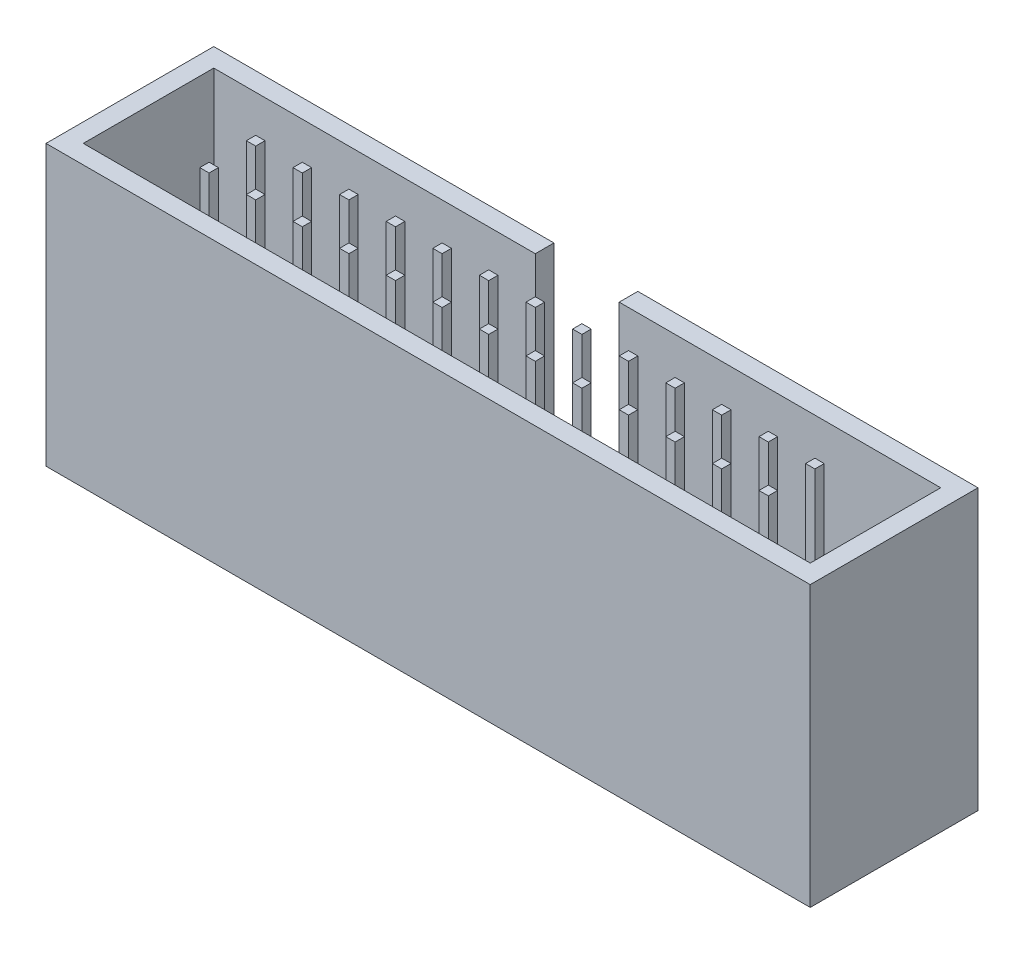
from build123d import *

# Parameters (mm, degrees)
SKETCH_504_W             = 41
SKETCH_504_H             = 9
EXTRUDE_794_DEPTH        = 15
CUT_EXTRUDE_START        = 15
SKETCH_4_W               = 39
SKETCH_4_H               = 7
CUT_EXTRUDE_8_DEPTH      = 10
SKETCH_5_W               = 4.5
SKETCH_5_H               = 6.901015062
CUT_EXTRUDE_9_DEPTH      = 10
SKETCH_6_W               = 0.5
SKETCH_6_H               = 0.5
EXTRUDE1_DEPTH           = 10
LPATTERN1_COUNT          = 7
LPATTERN1_PITCH          = 2.5
LPATTERN1_COUNT_DIR2     = 7
LPATTERN1_PITCH_DIR2     = 2.5
MIRROR1_COPY_1_SKETCH_W  = 0.5
MIRROR1_COPY_1_SKETCH_H  = 0.5
MIRROR1_COPY_1_DEPTH     = 10
MIRROR1_COPY_2_SKETCH_W  = 0.5
MIRROR1_COPY_2_SKETCH_H  = 0.5
MIRROR1_COPY_2_DEPTH     = 10
MIRROR1_COPY_3_SKETCH_W  = 0.5
MIRROR1_COPY_3_SKETCH_H  = 0.5
MIRROR1_COPY_3_DEPTH     = 10
MIRROR1_COPY_4_SKETCH_W  = 0.5
MIRROR1_COPY_4_SKETCH_H  = 0.5
MIRROR1_COPY_4_DEPTH     = 10
MIRROR1_COPY_5_SKETCH_W  = 0.5
MIRROR1_COPY_5_SKETCH_H  = 0.5
MIRROR1_COPY_5_DEPTH     = 10
MIRROR1_COPY_6_SKETCH_W  = 0.5
MIRROR1_COPY_6_SKETCH_H  = 0.5
MIRROR1_COPY_6_DEPTH     = 10
MIRROR1_COPY_7_SKETCH_W  = 0.5
MIRROR1_COPY_7_SKETCH_H  = 0.5
MIRROR1_COPY_7_DEPTH     = 10
MIRROR1_COPY_8_SKETCH_W  = 0.5
MIRROR1_COPY_8_SKETCH_H  = 0.5
MIRROR1_COPY_8_DEPTH     = 10
MIRROR1_COPY_9_SKETCH_W  = 0.5
MIRROR1_COPY_9_SKETCH_H  = 0.5
MIRROR1_COPY_9_DEPTH     = 10
MIRROR1_COPY_10_SKETCH_W = 0.5
MIRROR1_COPY_10_SKETCH_H = 0.5
MIRROR1_COPY_10_DEPTH    = 10
MIRROR1_COPY_11_SKETCH_W = 0.5
MIRROR1_COPY_11_SKETCH_H = 0.5
MIRROR1_COPY_11_DEPTH    = 10
MIRROR1_COPY_12_SKETCH_W = 0.5
MIRROR1_COPY_12_SKETCH_H = 0.5
MIRROR1_COPY_12_DEPTH    = 10
MIRROR1_COPY_13_SKETCH_W = 0.5
MIRROR1_COPY_13_SKETCH_H = 0.5
MIRROR1_COPY_13_DEPTH    = 10
MIRROR1_COPY_14_SKETCH_W = 0.5
MIRROR1_COPY_14_SKETCH_H = 0.5
MIRROR1_COPY_14_DEPTH    = 10
MIRROR1_COPY_15_SKETCH_W = 0.5
MIRROR1_COPY_15_SKETCH_H = 0.5
MIRROR1_COPY_15_DEPTH    = 10
MIRROR1_COPY_16_SKETCH_W = 0.5
MIRROR1_COPY_16_SKETCH_H = 0.5
MIRROR1_COPY_16_DEPTH    = 10
MIRROR1_COPY_17_SKETCH_W = 0.5
MIRROR1_COPY_17_SKETCH_H = 0.5
MIRROR1_COPY_17_DEPTH    = 10
MIRROR1_COPY_18_SKETCH_W = 0.5
MIRROR1_COPY_18_SKETCH_H = 0.5
MIRROR1_COPY_18_DEPTH    = 10
MIRROR1_COPY_19_SKETCH_W = 0.5
MIRROR1_COPY_19_SKETCH_H = 0.5
MIRROR1_COPY_19_DEPTH    = 10
MIRROR1_COPY_20_SKETCH_W = 0.5
MIRROR1_COPY_20_SKETCH_H = 0.5
MIRROR1_COPY_20_DEPTH    = 10
MIRROR1_COPY_21_SKETCH_W = 0.5
MIRROR1_COPY_21_SKETCH_H = 0.5
MIRROR1_COPY_21_DEPTH    = 10
MIRROR1_COPY_22_SKETCH_W = 0.5
MIRROR1_COPY_22_SKETCH_H = 0.5
MIRROR1_COPY_22_DEPTH    = 10
MIRROR1_COPY_23_SKETCH_W = 0.5
MIRROR1_COPY_23_SKETCH_H = 0.5
MIRROR1_COPY_23_DEPTH    = 10
MIRROR1_COPY_24_SKETCH_W = 0.5
MIRROR1_COPY_24_SKETCH_H = 0.5
MIRROR1_COPY_24_DEPTH    = 10
MIRROR1_COPY_25_SKETCH_W = 0.5
MIRROR1_COPY_25_SKETCH_H = 0.5
MIRROR1_COPY_25_DEPTH    = 10
MIRROR1_COPY_26_SKETCH_W = 0.5
MIRROR1_COPY_26_SKETCH_H = 0.5
MIRROR1_COPY_26_DEPTH    = 10
MIRROR1_COPY_27_SKETCH_W = 0.5
MIRROR1_COPY_27_SKETCH_H = 0.5
MIRROR1_COPY_27_DEPTH    = 10
MIRROR1_COPY_28_SKETCH_W = 0.5
MIRROR1_COPY_28_SKETCH_H = 0.5
MIRROR1_COPY_28_DEPTH    = 10
MIRROR1_COPY_29_SKETCH_W = 0.5
MIRROR1_COPY_29_SKETCH_H = 0.5
MIRROR1_COPY_29_DEPTH    = 10
MIRROR1_COPY_30_SKETCH_W = 0.5
MIRROR1_COPY_30_SKETCH_H = 0.5
MIRROR1_COPY_30_DEPTH    = 10
MIRROR1_COPY_31_SKETCH_W = 0.5
MIRROR1_COPY_31_SKETCH_H = 0.5
MIRROR1_COPY_31_DEPTH    = 10
MIRROR1_COPY_32_SKETCH_W = 0.5
MIRROR1_COPY_32_SKETCH_H = 0.5
MIRROR1_COPY_32_DEPTH    = 10
MIRROR1_COPY_33_SKETCH_W = 0.5
MIRROR1_COPY_33_SKETCH_H = 0.5
MIRROR1_COPY_33_DEPTH    = 10
MIRROR1_COPY_34_SKETCH_W = 0.5
MIRROR1_COPY_34_SKETCH_H = 0.5
MIRROR1_COPY_34_DEPTH    = 10
MIRROR1_COPY_35_SKETCH_W = 0.5
MIRROR1_COPY_35_SKETCH_H = 0.5
MIRROR1_COPY_35_DEPTH    = 10
MIRROR1_COPY_36_SKETCH_W = 0.5
MIRROR1_COPY_36_SKETCH_H = 0.5
MIRROR1_COPY_36_DEPTH    = 10
MIRROR1_COPY_37_SKETCH_W = 0.5
MIRROR1_COPY_37_SKETCH_H = 0.5
MIRROR1_COPY_37_DEPTH    = 10
MIRROR1_COPY_38_SKETCH_W = 0.5
MIRROR1_COPY_38_SKETCH_H = 0.5
MIRROR1_COPY_38_DEPTH    = 10
MIRROR1_COPY_39_SKETCH_W = 0.5
MIRROR1_COPY_39_SKETCH_H = 0.5
MIRROR1_COPY_39_DEPTH    = 10
MIRROR1_COPY_40_SKETCH_W = 0.5
MIRROR1_COPY_40_SKETCH_H = 0.5
MIRROR1_COPY_40_DEPTH    = 10
MIRROR1_COPY_41_SKETCH_W = 0.5
MIRROR1_COPY_41_SKETCH_H = 0.5
MIRROR1_COPY_41_DEPTH    = 10
MIRROR1_COPY_42_SKETCH_W = 0.5
MIRROR1_COPY_42_SKETCH_H = 0.5
MIRROR1_COPY_42_DEPTH    = 10
MIRROR1_COPY_43_SKETCH_W = 0.5
MIRROR1_COPY_43_SKETCH_H = 0.5
MIRROR1_COPY_43_DEPTH    = 10
MIRROR1_COPY_44_SKETCH_W = 0.5
MIRROR1_COPY_44_SKETCH_H = 0.5
MIRROR1_COPY_44_DEPTH    = 10
MIRROR1_COPY_45_SKETCH_W = 0.5
MIRROR1_COPY_45_SKETCH_H = 0.5
MIRROR1_COPY_45_DEPTH    = 10
MIRROR1_COPY_46_SKETCH_W = 0.5
MIRROR1_COPY_46_SKETCH_H = 0.5
MIRROR1_COPY_46_DEPTH    = 10
MIRROR1_COPY_47_SKETCH_W = 0.5
MIRROR1_COPY_47_SKETCH_H = 0.5
MIRROR1_COPY_47_DEPTH    = 10
MIRROR1_COPY_48_SKETCH_W = 0.5
MIRROR1_COPY_48_SKETCH_H = 0.5
MIRROR1_COPY_48_DEPTH    = 10
MIRROR1_COPY_49_SKETCH_W = 0.5
MIRROR1_COPY_49_SKETCH_H = 0.5
MIRROR1_COPY_49_DEPTH    = 10


with BuildPart() as part:
    # Sketch 504 → Extrude 794 (new body)
    with BuildSketch(Plane(origin=(0, 0, 0), x_dir=(1, 0, 0), z_dir=(0, 1, 0))):
        Rectangle(SKETCH_504_W, SKETCH_504_H)
    extrude(amount=EXTRUDE_794_DEPTH)

    # 草图4 → 切除-拉伸8 (cut)
    with BuildSketch(Plane(origin=(0, 0, 0), x_dir=(1, 0, 0), z_dir=(0, 1, 0)).offset(CUT_EXTRUDE_START)):
        Rectangle(SKETCH_4_W, SKETCH_4_H)
    extrude(amount=-CUT_EXTRUDE_8_DEPTH, mode=Mode.SUBTRACT)

    # 草图5 → 切除-拉伸9 (cut)
    with BuildSketch(Plane(origin=(0, 15, 0), x_dir=(1, 0, 0), z_dir=(0, 1, 0))):
        with Locations((0, 3.450507531)):
            Rectangle(SKETCH_5_W, SKETCH_5_H)
    extrude(amount=-CUT_EXTRUDE_9_DEPTH, mode=Mode.SUBTRACT)

    # 草图6 → Extrude1 (add)
    with BuildSketch(Plane(origin=(0, 5, 0), x_dir=(1, 0, 0), z_dir=(0, 1, 0))):
        with Locations((0, 1.25)):
            Rectangle(SKETCH_6_W, SKETCH_6_H)
    extrude1 = extrude(amount=EXTRUDE1_DEPTH)

    # LPattern1: Extrude1 7 × 7
    with Locations(*[Vector(1, 0, 0) * (i * LPATTERN1_PITCH) + Vector(-1, 0, 0) * (j * LPATTERN1_PITCH_DIR2) for i in range(LPATTERN1_COUNT) for j in range(LPATTERN1_COUNT_DIR2) if (i, j) != (0, 0)]):
        add(extrude1)

    # Mirror1 copy 1 sketch → Mirror1 copy 1 (add)
    with BuildSketch(Plane(origin=(-2.5, 5, 0), x_dir=(1, 0, 0), z_dir=(0, 1, 0))):
        with Locations((0, -1.25)):
            Rectangle(MIRROR1_COPY_1_SKETCH_W, MIRROR1_COPY_1_SKETCH_H)
    extrude(amount=MIRROR1_COPY_1_DEPTH)

    # Mirror1 copy 2 sketch → Mirror1 copy 2 (add)
    with BuildSketch(Plane(origin=(-5, 5, 0), x_dir=(1, 0, 0), z_dir=(0, 1, 0))):
        with Locations((0, -1.25)):
            Rectangle(MIRROR1_COPY_2_SKETCH_W, MIRROR1_COPY_2_SKETCH_H)
    extrude(amount=MIRROR1_COPY_2_DEPTH)

    # Mirror1 copy 3 sketch → Mirror1 copy 3 (add)
    with BuildSketch(Plane(origin=(-7.5, 5, 0), x_dir=(1, 0, 0), z_dir=(0, 1, 0))):
        with Locations((0, -1.25)):
            Rectangle(MIRROR1_COPY_3_SKETCH_W, MIRROR1_COPY_3_SKETCH_H)
    extrude(amount=MIRROR1_COPY_3_DEPTH)

    # Mirror1 copy 4 sketch → Mirror1 copy 4 (add)
    with BuildSketch(Plane(origin=(-10, 5, 0), x_dir=(1, 0, 0), z_dir=(0, 1, 0))):
        with Locations((0, -1.25)):
            Rectangle(MIRROR1_COPY_4_SKETCH_W, MIRROR1_COPY_4_SKETCH_H)
    extrude(amount=MIRROR1_COPY_4_DEPTH)

    # Mirror1 copy 5 sketch → Mirror1 copy 5 (add)
    with BuildSketch(Plane(origin=(-12.5, 5, 0), x_dir=(1, 0, 0), z_dir=(0, 1, 0))):
        with Locations((0, -1.25)):
            Rectangle(MIRROR1_COPY_5_SKETCH_W, MIRROR1_COPY_5_SKETCH_H)
    extrude(amount=MIRROR1_COPY_5_DEPTH)

    # Mirror1 copy 6 sketch → Mirror1 copy 6 (add)
    with BuildSketch(Plane(origin=(-15, 5, 0), x_dir=(1, 0, 0), z_dir=(0, 1, 0))):
        with Locations((0, -1.25)):
            Rectangle(MIRROR1_COPY_6_SKETCH_W, MIRROR1_COPY_6_SKETCH_H)
    extrude(amount=MIRROR1_COPY_6_DEPTH)

    # Mirror1 copy 7 sketch → Mirror1 copy 7 (add)
    with BuildSketch(Plane(origin=(2.5, 5, 0), x_dir=(1, 0, 0), z_dir=(0, 1, 0))):
        with Locations((0, -1.25)):
            Rectangle(MIRROR1_COPY_7_SKETCH_W, MIRROR1_COPY_7_SKETCH_H)
    extrude(amount=MIRROR1_COPY_7_DEPTH)

    # Mirror1 copy 8 sketch → Mirror1 copy 8 (add)
    with BuildSketch(Plane(origin=(0, 5, 0), x_dir=(1, 0, 0), z_dir=(0, 1, 0))):
        with Locations((0, -1.25)):
            Rectangle(MIRROR1_COPY_8_SKETCH_W, MIRROR1_COPY_8_SKETCH_H)
    extrude(amount=MIRROR1_COPY_8_DEPTH)

    # Mirror1 copy 9 sketch → Mirror1 copy 9 (add)
    with BuildSketch(Plane(origin=(-2.5, 5, 0), x_dir=(1, 0, 0), z_dir=(0, 1, 0))):
        with Locations((0, -1.25)):
            Rectangle(MIRROR1_COPY_9_SKETCH_W, MIRROR1_COPY_9_SKETCH_H)
    extrude(amount=MIRROR1_COPY_9_DEPTH)

    # Mirror1 copy 10 sketch → Mirror1 copy 10 (add)
    with BuildSketch(Plane(origin=(-5, 5, 0), x_dir=(1, 0, 0), z_dir=(0, 1, 0))):
        with Locations((0, -1.25)):
            Rectangle(MIRROR1_COPY_10_SKETCH_W, MIRROR1_COPY_10_SKETCH_H)
    extrude(amount=MIRROR1_COPY_10_DEPTH)

    # Mirror1 copy 11 sketch → Mirror1 copy 11 (add)
    with BuildSketch(Plane(origin=(-7.5, 5, 0), x_dir=(1, 0, 0), z_dir=(0, 1, 0))):
        with Locations((0, -1.25)):
            Rectangle(MIRROR1_COPY_11_SKETCH_W, MIRROR1_COPY_11_SKETCH_H)
    extrude(amount=MIRROR1_COPY_11_DEPTH)

    # Mirror1 copy 12 sketch → Mirror1 copy 12 (add)
    with BuildSketch(Plane(origin=(-10, 5, 0), x_dir=(1, 0, 0), z_dir=(0, 1, 0))):
        with Locations((0, -1.25)):
            Rectangle(MIRROR1_COPY_12_SKETCH_W, MIRROR1_COPY_12_SKETCH_H)
    extrude(amount=MIRROR1_COPY_12_DEPTH)

    # Mirror1 copy 13 sketch → Mirror1 copy 13 (add)
    with BuildSketch(Plane(origin=(-12.5, 5, 0), x_dir=(1, 0, 0), z_dir=(0, 1, 0))):
        with Locations((0, -1.25)):
            Rectangle(MIRROR1_COPY_13_SKETCH_W, MIRROR1_COPY_13_SKETCH_H)
    extrude(amount=MIRROR1_COPY_13_DEPTH)

    # Mirror1 copy 14 sketch → Mirror1 copy 14 (add)
    with BuildSketch(Plane(origin=(5, 5, 0), x_dir=(1, 0, 0), z_dir=(0, 1, 0))):
        with Locations((0, -1.25)):
            Rectangle(MIRROR1_COPY_14_SKETCH_W, MIRROR1_COPY_14_SKETCH_H)
    extrude(amount=MIRROR1_COPY_14_DEPTH)

    # Mirror1 copy 15 sketch → Mirror1 copy 15 (add)
    with BuildSketch(Plane(origin=(2.5, 5, 0), x_dir=(1, 0, 0), z_dir=(0, 1, 0))):
        with Locations((0, -1.25)):
            Rectangle(MIRROR1_COPY_15_SKETCH_W, MIRROR1_COPY_15_SKETCH_H)
    extrude(amount=MIRROR1_COPY_15_DEPTH)

    # Mirror1 copy 16 sketch → Mirror1 copy 16 (add)
    with BuildSketch(Plane(origin=(0, 5, 0), x_dir=(1, 0, 0), z_dir=(0, 1, 0))):
        with Locations((0, -1.25)):
            Rectangle(MIRROR1_COPY_16_SKETCH_W, MIRROR1_COPY_16_SKETCH_H)
    extrude(amount=MIRROR1_COPY_16_DEPTH)

    # Mirror1 copy 17 sketch → Mirror1 copy 17 (add)
    with BuildSketch(Plane(origin=(-2.5, 5, 0), x_dir=(1, 0, 0), z_dir=(0, 1, 0))):
        with Locations((0, -1.25)):
            Rectangle(MIRROR1_COPY_17_SKETCH_W, MIRROR1_COPY_17_SKETCH_H)
    extrude(amount=MIRROR1_COPY_17_DEPTH)

    # Mirror1 copy 18 sketch → Mirror1 copy 18 (add)
    with BuildSketch(Plane(origin=(-5, 5, 0), x_dir=(1, 0, 0), z_dir=(0, 1, 0))):
        with Locations((0, -1.25)):
            Rectangle(MIRROR1_COPY_18_SKETCH_W, MIRROR1_COPY_18_SKETCH_H)
    extrude(amount=MIRROR1_COPY_18_DEPTH)

    # Mirror1 copy 19 sketch → Mirror1 copy 19 (add)
    with BuildSketch(Plane(origin=(-7.5, 5, 0), x_dir=(1, 0, 0), z_dir=(0, 1, 0))):
        with Locations((0, -1.25)):
            Rectangle(MIRROR1_COPY_19_SKETCH_W, MIRROR1_COPY_19_SKETCH_H)
    extrude(amount=MIRROR1_COPY_19_DEPTH)

    # Mirror1 copy 20 sketch → Mirror1 copy 20 (add)
    with BuildSketch(Plane(origin=(-10, 5, 0), x_dir=(1, 0, 0), z_dir=(0, 1, 0))):
        with Locations((0, -1.25)):
            Rectangle(MIRROR1_COPY_20_SKETCH_W, MIRROR1_COPY_20_SKETCH_H)
    extrude(amount=MIRROR1_COPY_20_DEPTH)

    # Mirror1 copy 21 sketch → Mirror1 copy 21 (add)
    with BuildSketch(Plane(origin=(7.5, 5, 0), x_dir=(1, 0, 0), z_dir=(0, 1, 0))):
        with Locations((0, -1.25)):
            Rectangle(MIRROR1_COPY_21_SKETCH_W, MIRROR1_COPY_21_SKETCH_H)
    extrude(amount=MIRROR1_COPY_21_DEPTH)

    # Mirror1 copy 22 sketch → Mirror1 copy 22 (add)
    with BuildSketch(Plane(origin=(5, 5, 0), x_dir=(1, 0, 0), z_dir=(0, 1, 0))):
        with Locations((0, -1.25)):
            Rectangle(MIRROR1_COPY_22_SKETCH_W, MIRROR1_COPY_22_SKETCH_H)
    extrude(amount=MIRROR1_COPY_22_DEPTH)

    # Mirror1 copy 23 sketch → Mirror1 copy 23 (add)
    with BuildSketch(Plane(origin=(2.5, 5, 0), x_dir=(1, 0, 0), z_dir=(0, 1, 0))):
        with Locations((0, -1.25)):
            Rectangle(MIRROR1_COPY_23_SKETCH_W, MIRROR1_COPY_23_SKETCH_H)
    extrude(amount=MIRROR1_COPY_23_DEPTH)

    # Mirror1 copy 24 sketch → Mirror1 copy 24 (add)
    with BuildSketch(Plane(origin=(0, 5, 0), x_dir=(1, 0, 0), z_dir=(0, 1, 0))):
        with Locations((0, -1.25)):
            Rectangle(MIRROR1_COPY_24_SKETCH_W, MIRROR1_COPY_24_SKETCH_H)
    extrude(amount=MIRROR1_COPY_24_DEPTH)

    # Mirror1 copy 25 sketch → Mirror1 copy 25 (add)
    with BuildSketch(Plane(origin=(-2.5, 5, 0), x_dir=(1, 0, 0), z_dir=(0, 1, 0))):
        with Locations((0, -1.25)):
            Rectangle(MIRROR1_COPY_25_SKETCH_W, MIRROR1_COPY_25_SKETCH_H)
    extrude(amount=MIRROR1_COPY_25_DEPTH)

    # Mirror1 copy 26 sketch → Mirror1 copy 26 (add)
    with BuildSketch(Plane(origin=(-5, 5, 0), x_dir=(1, 0, 0), z_dir=(0, 1, 0))):
        with Locations((0, -1.25)):
            Rectangle(MIRROR1_COPY_26_SKETCH_W, MIRROR1_COPY_26_SKETCH_H)
    extrude(amount=MIRROR1_COPY_26_DEPTH)

    # Mirror1 copy 27 sketch → Mirror1 copy 27 (add)
    with BuildSketch(Plane(origin=(-7.5, 5, 0), x_dir=(1, 0, 0), z_dir=(0, 1, 0))):
        with Locations((0, -1.25)):
            Rectangle(MIRROR1_COPY_27_SKETCH_W, MIRROR1_COPY_27_SKETCH_H)
    extrude(amount=MIRROR1_COPY_27_DEPTH)

    # Mirror1 copy 28 sketch → Mirror1 copy 28 (add)
    with BuildSketch(Plane(origin=(10, 5, 0), x_dir=(1, 0, 0), z_dir=(0, 1, 0))):
        with Locations((0, -1.25)):
            Rectangle(MIRROR1_COPY_28_SKETCH_W, MIRROR1_COPY_28_SKETCH_H)
    extrude(amount=MIRROR1_COPY_28_DEPTH)

    # Mirror1 copy 29 sketch → Mirror1 copy 29 (add)
    with BuildSketch(Plane(origin=(7.5, 5, 0), x_dir=(1, 0, 0), z_dir=(0, 1, 0))):
        with Locations((0, -1.25)):
            Rectangle(MIRROR1_COPY_29_SKETCH_W, MIRROR1_COPY_29_SKETCH_H)
    extrude(amount=MIRROR1_COPY_29_DEPTH)

    # Mirror1 copy 30 sketch → Mirror1 copy 30 (add)
    with BuildSketch(Plane(origin=(5, 5, 0), x_dir=(1, 0, 0), z_dir=(0, 1, 0))):
        with Locations((0, -1.25)):
            Rectangle(MIRROR1_COPY_30_SKETCH_W, MIRROR1_COPY_30_SKETCH_H)
    extrude(amount=MIRROR1_COPY_30_DEPTH)

    # Mirror1 copy 31 sketch → Mirror1 copy 31 (add)
    with BuildSketch(Plane(origin=(2.5, 5, 0), x_dir=(1, 0, 0), z_dir=(0, 1, 0))):
        with Locations((0, -1.25)):
            Rectangle(MIRROR1_COPY_31_SKETCH_W, MIRROR1_COPY_31_SKETCH_H)
    extrude(amount=MIRROR1_COPY_31_DEPTH)

    # Mirror1 copy 32 sketch → Mirror1 copy 32 (add)
    with BuildSketch(Plane(origin=(0, 5, 0), x_dir=(1, 0, 0), z_dir=(0, 1, 0))):
        with Locations((0, -1.25)):
            Rectangle(MIRROR1_COPY_32_SKETCH_W, MIRROR1_COPY_32_SKETCH_H)
    extrude(amount=MIRROR1_COPY_32_DEPTH)

    # Mirror1 copy 33 sketch → Mirror1 copy 33 (add)
    with BuildSketch(Plane(origin=(-2.5, 5, 0), x_dir=(1, 0, 0), z_dir=(0, 1, 0))):
        with Locations((0, -1.25)):
            Rectangle(MIRROR1_COPY_33_SKETCH_W, MIRROR1_COPY_33_SKETCH_H)
    extrude(amount=MIRROR1_COPY_33_DEPTH)

    # Mirror1 copy 34 sketch → Mirror1 copy 34 (add)
    with BuildSketch(Plane(origin=(-5, 5, 0), x_dir=(1, 0, 0), z_dir=(0, 1, 0))):
        with Locations((0, -1.25)):
            Rectangle(MIRROR1_COPY_34_SKETCH_W, MIRROR1_COPY_34_SKETCH_H)
    extrude(amount=MIRROR1_COPY_34_DEPTH)

    # Mirror1 copy 35 sketch → Mirror1 copy 35 (add)
    with BuildSketch(Plane(origin=(12.5, 5, 0), x_dir=(1, 0, 0), z_dir=(0, 1, 0))):
        with Locations((0, -1.25)):
            Rectangle(MIRROR1_COPY_35_SKETCH_W, MIRROR1_COPY_35_SKETCH_H)
    extrude(amount=MIRROR1_COPY_35_DEPTH)

    # Mirror1 copy 36 sketch → Mirror1 copy 36 (add)
    with BuildSketch(Plane(origin=(10, 5, 0), x_dir=(1, 0, 0), z_dir=(0, 1, 0))):
        with Locations((0, -1.25)):
            Rectangle(MIRROR1_COPY_36_SKETCH_W, MIRROR1_COPY_36_SKETCH_H)
    extrude(amount=MIRROR1_COPY_36_DEPTH)

    # Mirror1 copy 37 sketch → Mirror1 copy 37 (add)
    with BuildSketch(Plane(origin=(7.5, 5, 0), x_dir=(1, 0, 0), z_dir=(0, 1, 0))):
        with Locations((0, -1.25)):
            Rectangle(MIRROR1_COPY_37_SKETCH_W, MIRROR1_COPY_37_SKETCH_H)
    extrude(amount=MIRROR1_COPY_37_DEPTH)

    # Mirror1 copy 38 sketch → Mirror1 copy 38 (add)
    with BuildSketch(Plane(origin=(5, 5, 0), x_dir=(1, 0, 0), z_dir=(0, 1, 0))):
        with Locations((0, -1.25)):
            Rectangle(MIRROR1_COPY_38_SKETCH_W, MIRROR1_COPY_38_SKETCH_H)
    extrude(amount=MIRROR1_COPY_38_DEPTH)

    # Mirror1 copy 39 sketch → Mirror1 copy 39 (add)
    with BuildSketch(Plane(origin=(2.5, 5, 0), x_dir=(1, 0, 0), z_dir=(0, 1, 0))):
        with Locations((0, -1.25)):
            Rectangle(MIRROR1_COPY_39_SKETCH_W, MIRROR1_COPY_39_SKETCH_H)
    extrude(amount=MIRROR1_COPY_39_DEPTH)

    # Mirror1 copy 40 sketch → Mirror1 copy 40 (add)
    with BuildSketch(Plane(origin=(0, 5, 0), x_dir=(1, 0, 0), z_dir=(0, 1, 0))):
        with Locations((0, -1.25)):
            Rectangle(MIRROR1_COPY_40_SKETCH_W, MIRROR1_COPY_40_SKETCH_H)
    extrude(amount=MIRROR1_COPY_40_DEPTH)

    # Mirror1 copy 41 sketch → Mirror1 copy 41 (add)
    with BuildSketch(Plane(origin=(-2.5, 5, 0), x_dir=(1, 0, 0), z_dir=(0, 1, 0))):
        with Locations((0, -1.25)):
            Rectangle(MIRROR1_COPY_41_SKETCH_W, MIRROR1_COPY_41_SKETCH_H)
    extrude(amount=MIRROR1_COPY_41_DEPTH)

    # Mirror1 copy 42 sketch → Mirror1 copy 42 (add)
    with BuildSketch(Plane(origin=(15, 5, 0), x_dir=(1, 0, 0), z_dir=(0, 1, 0))):
        with Locations((0, -1.25)):
            Rectangle(MIRROR1_COPY_42_SKETCH_W, MIRROR1_COPY_42_SKETCH_H)
    extrude(amount=MIRROR1_COPY_42_DEPTH)

    # Mirror1 copy 43 sketch → Mirror1 copy 43 (add)
    with BuildSketch(Plane(origin=(12.5, 5, 0), x_dir=(1, 0, 0), z_dir=(0, 1, 0))):
        with Locations((0, -1.25)):
            Rectangle(MIRROR1_COPY_43_SKETCH_W, MIRROR1_COPY_43_SKETCH_H)
    extrude(amount=MIRROR1_COPY_43_DEPTH)

    # Mirror1 copy 44 sketch → Mirror1 copy 44 (add)
    with BuildSketch(Plane(origin=(10, 5, 0), x_dir=(1, 0, 0), z_dir=(0, 1, 0))):
        with Locations((0, -1.25)):
            Rectangle(MIRROR1_COPY_44_SKETCH_W, MIRROR1_COPY_44_SKETCH_H)
    extrude(amount=MIRROR1_COPY_44_DEPTH)

    # Mirror1 copy 45 sketch → Mirror1 copy 45 (add)
    with BuildSketch(Plane(origin=(7.5, 5, 0), x_dir=(1, 0, 0), z_dir=(0, 1, 0))):
        with Locations((0, -1.25)):
            Rectangle(MIRROR1_COPY_45_SKETCH_W, MIRROR1_COPY_45_SKETCH_H)
    extrude(amount=MIRROR1_COPY_45_DEPTH)

    # Mirror1 copy 46 sketch → Mirror1 copy 46 (add)
    with BuildSketch(Plane(origin=(5, 5, 0), x_dir=(1, 0, 0), z_dir=(0, 1, 0))):
        with Locations((0, -1.25)):
            Rectangle(MIRROR1_COPY_46_SKETCH_W, MIRROR1_COPY_46_SKETCH_H)
    extrude(amount=MIRROR1_COPY_46_DEPTH)

    # Mirror1 copy 47 sketch → Mirror1 copy 47 (add)
    with BuildSketch(Plane(origin=(2.5, 5, 0), x_dir=(1, 0, 0), z_dir=(0, 1, 0))):
        with Locations((0, -1.25)):
            Rectangle(MIRROR1_COPY_47_SKETCH_W, MIRROR1_COPY_47_SKETCH_H)
    extrude(amount=MIRROR1_COPY_47_DEPTH)

    # Mirror1 copy 48 sketch → Mirror1 copy 48 (add)
    with BuildSketch(Plane(origin=(0, 5, 0), x_dir=(1, 0, 0), z_dir=(0, 1, 0))):
        with Locations((0, -1.25)):
            Rectangle(MIRROR1_COPY_48_SKETCH_W, MIRROR1_COPY_48_SKETCH_H)
    extrude(amount=MIRROR1_COPY_48_DEPTH)

    # Mirror1 copy 49 sketch → Mirror1 copy 49 (add)
    with BuildSketch(Plane(origin=(0, 5, 0), x_dir=(1, 0, 0), z_dir=(0, 1, 0))):
        with Locations((0, -1.25)):
            Rectangle(MIRROR1_COPY_49_SKETCH_W, MIRROR1_COPY_49_SKETCH_H)
    extrude(amount=MIRROR1_COPY_49_DEPTH)


solid = part.part
